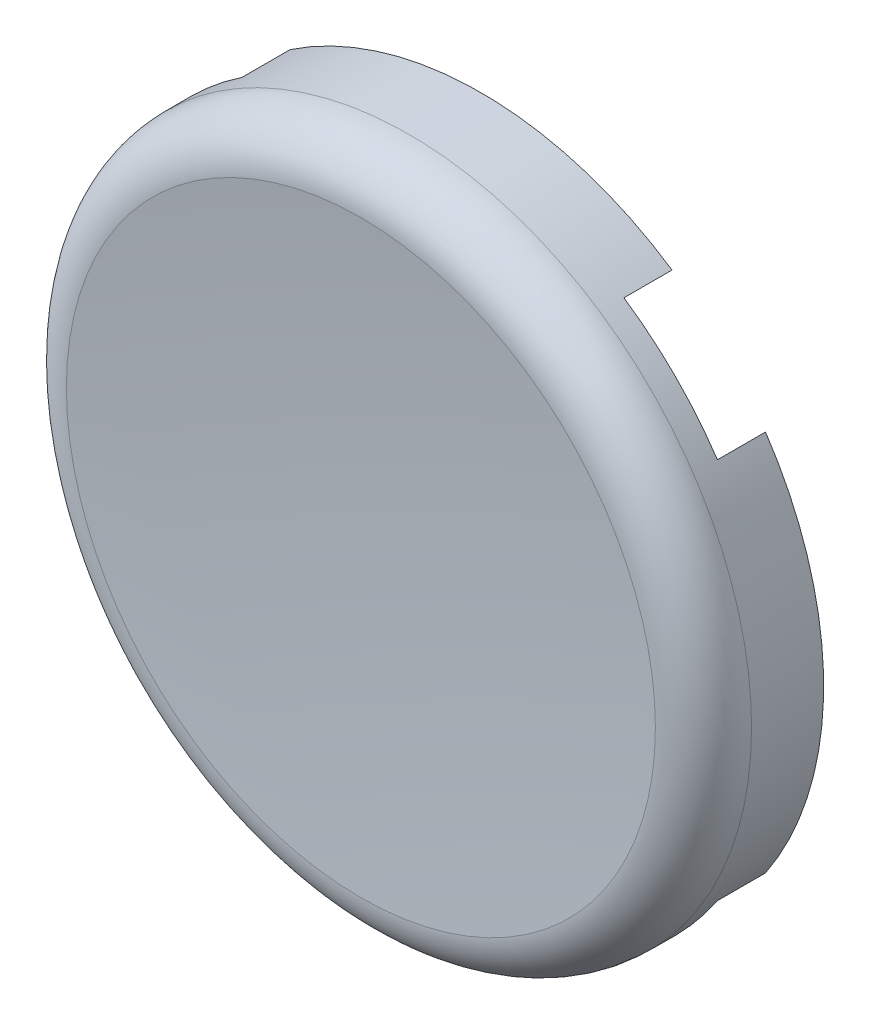
from build123d import *

# Parameters (mm, degrees)
SKETCH1_W          = 9.95
SKETCH1_H          = 0.5
SKETCH1_W_2        = 2.8
SKETCH1_H_2        = 1.2
CUT_EXTRUDE2_START = 2
CUT_EXTRUDE2_DEPTH = 2
SKETCH3_W          = 1.17
SKETCH3_H          = 1.465
SKETCH3_H_2        = 1.17
SKETCH3_W_2        = 1.465
CUT_EXTRUDE3_DEPTH = 4.3
FILLET1_R          = 0.3
FILLET2_R          = 1
FILLET3_R          = 2


with BuildPart() as part:
    # Sketch1 → Revolve1 (revolve)
    with BuildSketch(Plane(origin=(0, 0, 0), x_dir=(1, 0, 0), z_dir=(0, 1, 0)), mode=Mode.PRIVATE) as revolve1_sk:
        with BuildLine():
            Line((2.8, 0), (0, 0))
            Line((0, 0), (0, -4.5))
            ThreePointArc((0, -4.5), (6.130099918, -4.625052018), (12.25, -5))
            Line((12.25, -5), (14.25, -5))
            Line((14.25, -5), (14.25, 0))
            Line((14.25, 0), (12.75, 0))
            Line((12.75, 0), (12.75, -3.1))
            Line((12.75, -3.1), (12.75, -3.6))
            Line((12.75, -3.6), (2.8, -3.6))
            Line((2.8, -3.6), (2.8, -3.1))
            Line((2.8, -3.1), (2.8, 0))
        make_face()
        with Locations((7.775, -3.35)):
            Rectangle(SKETCH1_W, SKETCH1_H)
        with Locations((1.4, 0.6)):
            Rectangle(SKETCH1_W_2, SKETCH1_H_2)
    revolve(revolve1_sk.sketch.rotate(Axis((0, 0, 0), (0, 0, 1)), 180), axis=Axis((0, 0, 0), (0, 0, 1)))

    # Sketch2 → Cut-Extrude2 (cut)
    with BuildSketch(Plane.XY.offset(CUT_EXTRUDE2_START)):
        with BuildLine():
            Line((10.747952079, 9.404591185), (9.404591185, 10.747952079))
            Line((9.404591185, 10.747952079), (6.858864783, 10.747952079))
            ThreePointArc((6.858864783, 10.747952079), (9.01561146, 9.01561146), (10.747952079, 6.858864783))
            Line((10.747952079, 6.858864783), (10.747952079, 9.404591185))
        make_face()
        Polygon((9.404591185, 10.747952079), (8.131727984, 12.02081528), (6.858864783, 10.747952079), align=None)
        Polygon((12.02081528, 8.131727984), (10.747952079, 9.404591185), (10.747952079, 6.858864783), align=None)
        Polygon((12.02081528, -8.131727984), (10.747952079, -6.858864783), (10.747952079, -9.404591185), align=None)
        with BuildLine():
            Line((10.747952079, -9.404591185), (10.747952079, -6.858864783))
            ThreePointArc((10.747952079, -6.858864783), (9.01561146, -9.01561146), (6.858864783, -10.747952079))
            Line((6.858864783, -10.747952079), (9.404591185, -10.747952079))
            Line((9.404591185, -10.747952079), (10.747952079, -9.404591185))
        make_face()
        Polygon((9.404591185, -10.747952079), (6.858864783, -10.747952079), (8.131727984, -12.02081528), align=None)
        Polygon((-8.131727984, -12.02081528), (-6.858864783, -10.747952079), (-9.404591185, -10.747952079), align=None)
        with BuildLine():
            ThreePointArc((-6.858864783, -10.747952079), (-9.01561146, -9.01561146), (-10.747952079, -6.858864783))
            Line((-10.747952079, -6.858864783), (-10.747952079, -9.404591185))
            Line((-10.747952079, -9.404591185), (-9.404591185, -10.747952079))
            Line((-9.404591185, -10.747952079), (-6.858864783, -10.747952079))
        make_face()
        Polygon((-10.747952079, -9.404591185), (-10.747952079, -6.858864783), (-12.02081528, -8.131727984), align=None)
        Polygon((-12.02081528, 8.131727984), (-10.747952079, 6.858864783), (-10.747952079, 9.404591185), align=None)
        with BuildLine():
            ThreePointArc((-10.747952079, 6.858864783), (-9.01561146, 9.01561146), (-6.858864783, 10.747952079))
            Line((-6.858864783, 10.747952079), (-9.404591185, 10.747952079))
            Line((-9.404591185, 10.747952079), (-10.747952079, 9.404591185))
            Line((-10.747952079, 9.404591185), (-10.747952079, 6.858864783))
        make_face()
        Polygon((-9.404591185, 10.747952079), (-6.858864783, 10.747952079), (-8.131727984, 12.02081528), align=None)
    extrude(amount=-CUT_EXTRUDE2_DEPTH, mode=Mode.SUBTRACT)

    # Sketch3 → Cut-Extrude3 (cut)
    with BuildSketch(Plane(origin=(0, 0, -1.2), x_dir=(-1, 0, 0), z_dir=(0, 0, -1))):
        with Locations((0, 1.3175)):
            Rectangle(SKETCH3_W, SKETCH3_H)
        Rectangle(SKETCH3_W, SKETCH3_H_2)
        with Locations((0, -1.3175)):
            Rectangle(SKETCH3_W, SKETCH3_H)
        with Locations((-1.3175, 0)):
            Rectangle(SKETCH3_W_2, SKETCH3_H_2)
        with Locations((1.3175, 0)):
            Rectangle(SKETCH3_W_2, SKETCH3_H_2)
    extrude(amount=-CUT_EXTRUDE3_DEPTH, mode=Mode.SUBTRACT)

    # Fillet1
    fillet1_edges = [part.edges().sort_by_distance(p)[0] for p in [
        (0.585, 0.585, 0.95),
        (0.585, -0.585, 0.95),
        (-0.585, -0.585, 0.95),
        (-0.585, 0.585, 0.95),
    ]]
    fillet(fillet1_edges, radius=FILLET1_R)

    # Fillet2
    fillet2_edges = [part.edges().sort_by_distance(p)[0] for p in [
        (12.75, 0, 3.1),
    ]]
    fillet(fillet2_edges, radius=FILLET2_R)

    # Fillet3
    fillet3_edges = [part.edges().sort_by_distance(p)[0] for p in [
        (14.25, 0, 5),
    ]]
    fillet(fillet3_edges, radius=FILLET3_R - 0.0001)  # a hair under: the kernel refuses the full size


solid = part.part
